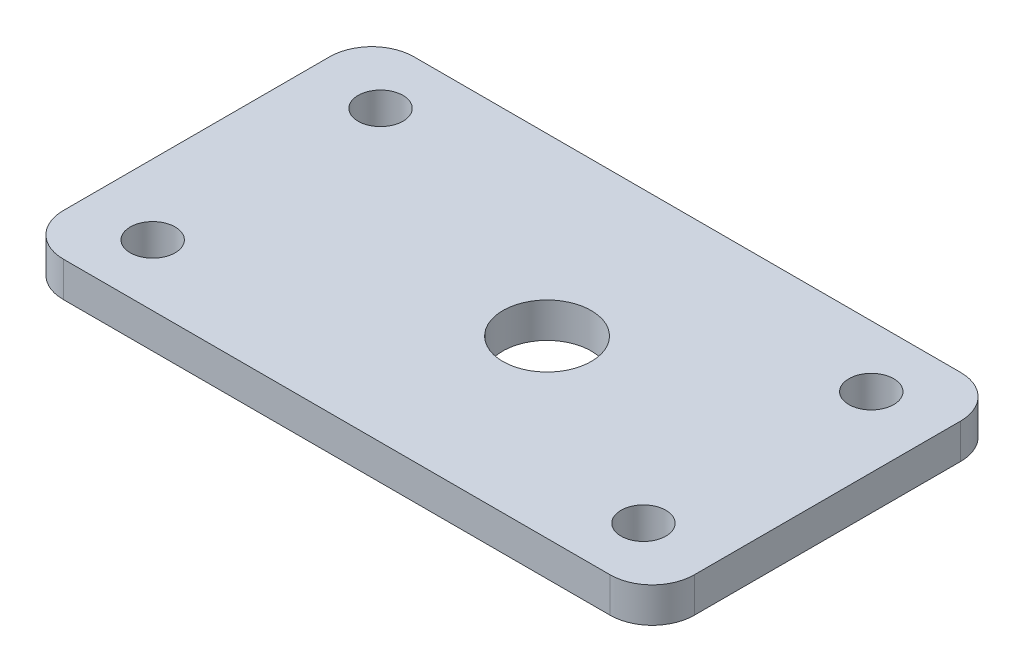
from build123d import *

# Parameters (mm, degrees)
SKETCH1_W           = 57.15
SKETCH1_H           = 31.75
SKETCH1_R           = 4
BOSS_EXTRUDE1_DEPTH = 3.175
FILLET1_R           = 3.81
SKETCH2_R           = 2.032
CUT_EXTRUDE1_DEPTH  = 33.842455374


with BuildPart() as part:
    # Sketch1 → Boss-Extrude1 (new body)
    with BuildSketch(Plane(origin=(0, 0, 0), x_dir=(1, 0, 0), z_dir=(0, 1, 0))):
        Rectangle(SKETCH1_W, SKETCH1_H)
        with Locations((3.175, 0)):
            Circle(SKETCH1_R, mode=Mode.SUBTRACT)
    extrude(amount=BOSS_EXTRUDE1_DEPTH)

    # Fillet1
    fillet1_edges = [part.edges().sort_by_distance(p)[0] for p in [
        (28.575, 1.5875, -15.875),
        (28.575, 1.5875, 15.875),
        (-28.575, 1.5875, 15.875),
        (-28.575, 1.5875, -15.875),
    ]]
    fillet(fillet1_edges, radius=FILLET1_R)

    # Sketch2 → Cut-Extrude1 (cut, through all)
    with BuildSketch(Plane.XZ):
        with Locations((22.225, -10.31875)):
            Circle(SKETCH2_R)
        with Locations((22.225, 10.31875)):
            Circle(SKETCH2_R)
        with Locations((-22.225, -10.31875)):
            Circle(SKETCH2_R)
        with Locations((-22.225, 10.31875)):
            Circle(SKETCH2_R)
    extrude(amount=-CUT_EXTRUDE1_DEPTH, mode=Mode.SUBTRACT)


solid = part.part
